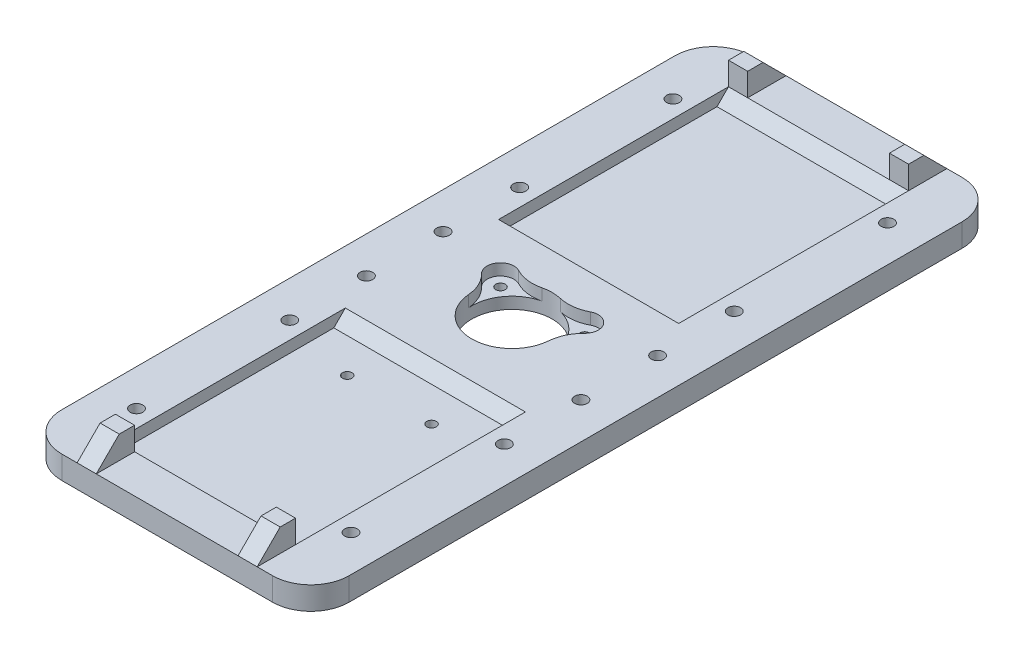
from build123d import *

# Parameters (mm, degrees)
SKETCH1_W           = 75
SKETCH1_H           = 180
BOSS_EXTRUDE1_DEPTH = 6
FILLET1_R           = 10
SKETCH2_R           = 10.5
SKETCH2_R_2         = 1.25
SKETCH2_R_3         = 1.65
CUT_EXTRUDE1_DEPTH  = 10
CUT_EXTRUDE2_DEPTH  = 3
SKETCH5_R           = 3.5
SKETCH5_W           = 47
SKETCH5_H           = 60
CUT_EXTRUDE3_DEPTH  = 3
FILLET2_R           = 10
CHAMFER1_SIZE       = 3
SKETCH6_W           = 5
SKETCH6_H           = 10
BOSS_EXTRUDE2_DEPTH = 6
CHAMFER2_SIZE       = 6


with BuildPart() as part:
    # Sketch1 → Boss-Extrude1 (new body)
    with BuildSketch(Plane(origin=(0, 0, 0), x_dir=(1, 0, 0), z_dir=(0, 1, 0))):
        Rectangle(SKETCH1_W, SKETCH1_H)
    extrude(amount=BOSS_EXTRUDE1_DEPTH)

    # Fillet1
    fillet1_edges = [part.edges().sort_by_distance(p)[0] for p in [
        (-37.5, 3, -90),
        (37.5, 3, -90),
        (37.5, 3, 90),
        (-37.5, 3, 90),
    ]]
    fillet(fillet1_edges, radius=FILLET1_R)

    # Sketch2 → Cut-Extrude1 (cut)
    with BuildSketch(Plane(origin=(0, 6, 0), x_dir=(1, 0, 0), z_dir=(0, 1, 0))):
        with Locations(Location((0, 0, 0), (0, 0, 270))):
            Circle(SKETCH2_R)
        with Locations(Location((-11, 8, 0), (0, 0, 270))):
            Circle(SKETCH2_R_2)
        with Locations(Location((11, 8, 0), (0, 0, 270))):
            Circle(SKETCH2_R_2)
        with Locations(Location((-11, -32, 0), (0, 0, 270))):
            Circle(SKETCH2_R_2)
        with Locations(Location((11, -32, 0), (0, 0, 270))):
            Circle(SKETCH2_R_2)
        with Locations(Location((-28, -70, 0), (0, 0, 270))):
            Circle(SKETCH2_R_3)
        with Locations(Location((28, -70, 0), (0, 0, 270))):
            Circle(SKETCH2_R_3)
        with Locations(Location((-28, 70, 0), (0, 0, 270))):
            Circle(SKETCH2_R_3)
        with Locations(Location((28, 70, 0), (0, 0, 270))):
            Circle(SKETCH2_R_3)
        with Locations(Location((-28, 10, 0), (0, 0, 270))):
            Circle(SKETCH2_R_3)
        with Locations(Location((-28, -10, 0), (0, 0, 270))):
            Circle(SKETCH2_R_3)
        with Locations(Location((28, 10, 0), (0, 0, 270))):
            Circle(SKETCH2_R_3)
        with Locations(Location((28, -10, 0), (0, 0, 270))):
            Circle(SKETCH2_R_3)
        with Locations(Location((-28, 30, 0), (0, 0, 270))):
            Circle(SKETCH2_R_3)
        with Locations(Location((28, 30, 0), (0, 0, 270))):
            Circle(SKETCH2_R_3)
        with Locations(Location((28, -30, 0), (0, 0, 270))):
            Circle(SKETCH2_R_3)
        with Locations(Location((-28, -30, 0), (0, 0, 270))):
            Circle(SKETCH2_R_3)
    extrude(amount=-CUT_EXTRUDE1_DEPTH, mode=Mode.SUBTRACT)

    # Sketch4 → Cut-Extrude2 (cut)
    with BuildSketch(Plane.XZ):
        Polygon((-28, 6.766838493), (-25.2, 8.383419246), (-25.2, 11.616580754), (-28, 13.233161507), (-30.8, 11.616580754), (-30.8, 8.383419246), align=None)
        Polygon((-27.920583163, -13.232185994), (-25.161136401, -11.547315999), (-25.240553238, -8.315130005), (-28.079416837, -6.767814006), (-30.838863599, -8.452684001), (-30.759446762, -11.684869995), align=None)
        Polygon((28, -13.233161507), (30.8, -11.616580754), (30.8, -8.383419246), (28, -6.766838493), (25.2, -8.383419246), (25.2, -11.616580754), align=None)
        Polygon((28, 6.766838493), (30.8, 8.383419246), (30.8, 11.616580754), (28, 13.233161507), (25.2, 11.616580754), (25.2, 8.383419246), align=None)
        Polygon((28, 66.766838493), (30.8, 68.383419246), (30.8, 71.616580754), (28, 73.233161507), (25.2, 71.616580754), (25.2, 68.383419246), align=None)
        Polygon((-28, 66.766838493), (-25.2, 68.383419246), (-25.2, 71.616580754), (-28, 73.233161507), (-30.8, 71.616580754), (-30.8, 68.383419246), align=None)
        Polygon((28, -73.233161507), (30.8, -71.616580754), (30.8, -68.383419246), (28, -66.766838493), (25.2, -68.383419246), (25.2, -71.616580754), align=None)
        Polygon((-28, -73.233161507), (-25.2, -71.616580754), (-25.2, -68.383419246), (-28, -66.766838493), (-30.8, -68.383419246), (-30.8, -71.616580754), align=None)
    extrude(amount=-CUT_EXTRUDE2_DEPTH, mode=Mode.SUBTRACT)

    # Sketch5 → Cut-Extrude3 (cut)
    with BuildSketch(Plane(origin=(0, 6, 0), x_dir=(1, 0, 0), z_dir=(0, 1, 0))):
        with Locations((-11, 8)):
            Circle(SKETCH5_R)
        with Locations((11, 8)):
            Circle(SKETCH5_R)
        with Locations((0, 50)):
            Rectangle(SKETCH5_W, SKETCH5_H)
        with Locations((0, -50)):
            Rectangle(SKETCH5_W, SKETCH5_H)
    extrude(amount=-CUT_EXTRUDE3_DEPTH, mode=Mode.SUBTRACT)

    # Fillet2
    fillet2_edges = [part.edges().sort_by_distance(p)[0] for p in [
        (-7.57722899, 4.5, -7.268810139),
        (-9.249798037, 4.5, -4.969027699),
        (9.249798037, 4.5, -4.969027699),
        (7.57722899, 4.5, -7.268810139),
    ]]
    fillet(fillet2_edges, radius=FILLET2_R)

    # Chamfer1
    chamfer1_edges = [part.edges().sort_by_distance(p)[0] for p in [
        (0, 3, 80),
        (0, 3, -80),
        (0, 3, -20),
        (0, 3, 20),
    ]]
    chamfer(chamfer1_edges, length=CHAMFER1_SIZE - 0.0001)  # a hair under: the kernel refuses the full size

    # Sketch6 → Boss-Extrude2 (add)
    with BuildSketch(Plane(origin=(0, 6, 0), x_dir=(1, 0, 0), z_dir=(0, 1, 0))):
        with Locations((-21, 85)):
            Rectangle(SKETCH6_W, SKETCH6_H)
        with Locations((21, -85)):
            Rectangle(SKETCH6_W, SKETCH6_H)
        with Locations((21, 85)):
            Rectangle(SKETCH6_W, SKETCH6_H)
        with Locations((-21, -85)):
            Rectangle(SKETCH6_W, SKETCH6_H)
    extrude(amount=BOSS_EXTRUDE2_DEPTH)

    # Chamfer2
    chamfer2_edges = [part.edges().sort_by_distance(p)[0] for p in [
        (21, 12, 90),
        (-21, 12, -90),
        (21, 12, -90),
        (-21, 12, 90),
    ]]
    chamfer(chamfer2_edges, length=CHAMFER2_SIZE)


solid = part.part
